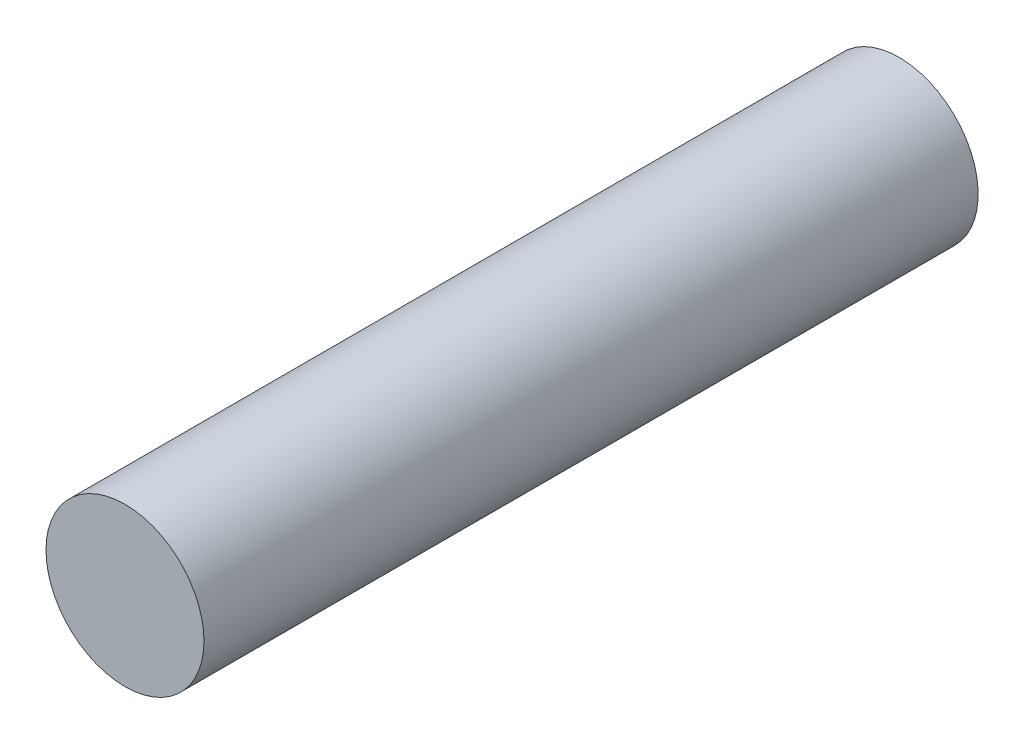
from build123d import *

# Parameters (mm, degrees)
BOSS_EXTRUDE1_START     = -62.23
BOSS_EXTRUDE1_OUTLINE_R = 6.35
BOSS_EXTRUDE1_DEPTH     = 62.23


# Read off the part's stored shape, not the designer's step: Boss-Extrude1
with BuildPart() as part:
    # Boss-Extrude1 outline → Boss-Extrude1 (new body)
    with BuildSketch(Plane(origin=(0, 0, -22.86), x_dir=(-1, 0, 0), z_dir=(0, 0, -1)).offset(BOSS_EXTRUDE1_START)):
        Circle(BOSS_EXTRUDE1_OUTLINE_R)
    extrude(amount=BOSS_EXTRUDE1_DEPTH)


solid = part.part
